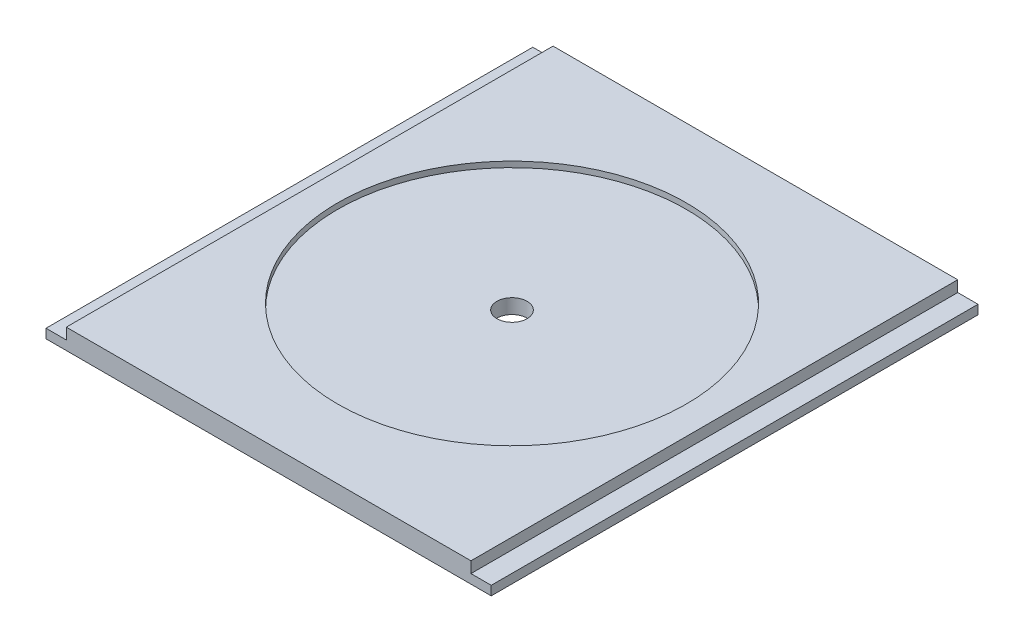
from build123d import *

# Parameters (mm, degrees)
SKETCH1_W           = 139.40028
SKETCH1_H           = 152.4
BOSS_EXTRUDE1_DEPTH = 6.35
SKETCH2_W           = 6.35
SKETCH2_H           = 152.4
CUT_EXTRUDE1_DEPTH  = 3.47472
SKETCH3_R           = 54.58206
CUT_EXTRUDE2_DEPTH  = 1.778
SKETCH4_R           = 4.72186
CUT_EXTRUDE3_DEPTH  = 207.589208934


with BuildPart() as part:
    # Sketch1 → Boss-Extrude1 (new body)
    with BuildSketch(Plane(origin=(0, 0, 0), x_dir=(1, 0, 0), z_dir=(0, 1, 0))):
        with Locations((69.70014, 76.2)):
            Rectangle(SKETCH1_W, SKETCH1_H)
    extrude(amount=BOSS_EXTRUDE1_DEPTH)

    # Sketch2 → Cut-Extrude1 (cut)
    with BuildSketch(Plane(origin=(0, 6.35, 0), x_dir=(1, 0, 0), z_dir=(0, 1, 0))):
        with Locations((3.175, 76.2)):
            Rectangle(SKETCH2_W, SKETCH2_H)
        with Locations((136.22528, 76.2)):
            Rectangle(SKETCH2_W, SKETCH2_H)
    extrude(amount=-CUT_EXTRUDE1_DEPTH, mode=Mode.SUBTRACT)

    # Sketch3 → Cut-Extrude2 (cut)
    with BuildSketch(Plane(origin=(0, 6.35, 0), x_dir=(1, 0, 0), z_dir=(0, 1, 0))):
        with Locations((69.70014, 76.2)):
            Circle(SKETCH3_R)
    extrude(amount=-CUT_EXTRUDE2_DEPTH, mode=Mode.SUBTRACT)

    # Sketch4 → Cut-Extrude3 (cut, through all)
    with BuildSketch(Plane(origin=(0, 4.572, 0), x_dir=(1, 0, 0), z_dir=(0, 1, 0))):
        with Locations((69.70014, 76.2)):
            Circle(SKETCH4_R)
    extrude(amount=-CUT_EXTRUDE3_DEPTH, mode=Mode.SUBTRACT)


solid = part.part
